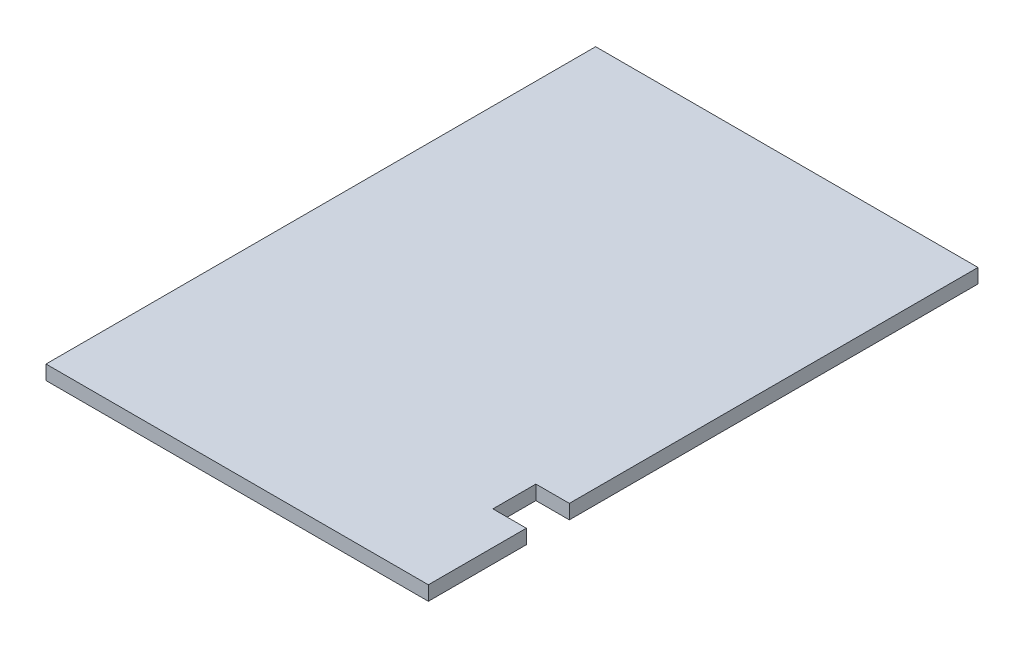
from build123d import *

# Parameters (mm, degrees)
SKETCH1_W           = 80
SKETCH1_H           = 105
BOSS_EXTRUDE1_DEPTH = 3
SKETCH4_W           = 80
SKETCH4_H           = 3
BOSS_EXTRUDE3_DEPTH = 10
SKETCH9_W           = 7
SKETCH9_H           = 9
CUT_EXTRUDE1_DEPTH  = 10


with BuildPart() as part:
    # Sketch1 → Boss-Extrude1 (new body)
    with BuildSketch(Plane(origin=(0, 0, 0), x_dir=(1, 0, 0), z_dir=(0, 1, 0))):
        with Locations((40, 52.5)):
            Rectangle(SKETCH1_W, SKETCH1_H)
    extrude(amount=BOSS_EXTRUDE1_DEPTH)

    # Sketch4 → Boss-Extrude3 (add)
    with BuildSketch(Plane.XY):
        with Locations((40, 1.5)):
            Rectangle(SKETCH4_W, SKETCH4_H)
    extrude(amount=BOSS_EXTRUDE3_DEPTH)

    # Sketch9 → Cut-Extrude1 (cut)
    with BuildSketch(Plane(origin=(0, 3, 0), x_dir=(1, 0, 0), z_dir=(0, 1, 0))):
        with Locations((76.5, 15)):
            Rectangle(SKETCH9_W, SKETCH9_H)
    extrude(amount=-CUT_EXTRUDE1_DEPTH, mode=Mode.SUBTRACT)


solid = part.part
